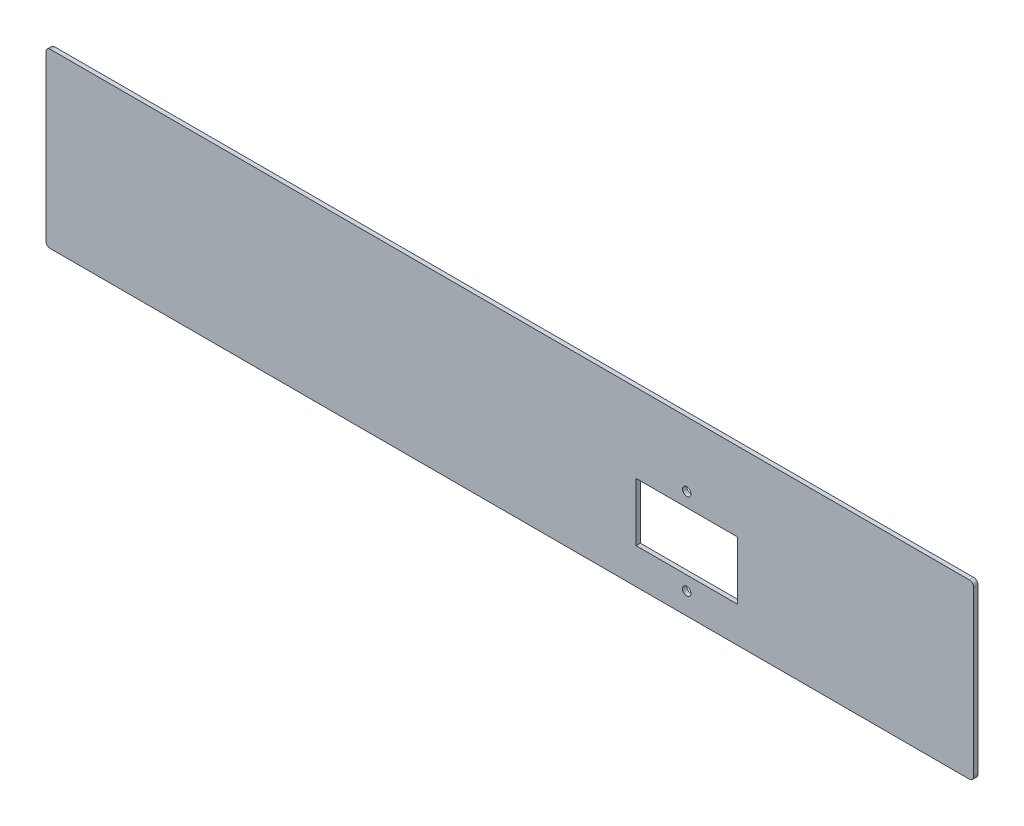
from build123d import *

# Parameters (mm, degrees)
SKETCH1_W           = 430
SKETCH1_H           = 80
SKETCH1_R           = 1.95
SKETCH1_W_2         = 47
SKETCH1_H_2         = 27
BOSS_EXTRUDE1_DEPTH = 2
FILLET1_R           = 2


with BuildPart() as part:
    # Sketch1 → Boss-Extrude1 (new body)
    with BuildSketch(Plane.XY):
        with Locations((-137.924811832, 5.703517588)):
            Rectangle(SKETCH1_W, SKETCH1_H)
        with Locations((-55.924811832, 15.703517588)):
            Circle(SKETCH1_R, mode=Mode.SUBTRACT)
        with Locations((-55.924811832, -24.296482412)):
            Circle(SKETCH1_R, mode=Mode.SUBTRACT)
        with Locations((-55.924811832, -4.296482412)):
            Rectangle(SKETCH1_W_2, SKETCH1_H_2, mode=Mode.SUBTRACT)
    extrude(amount=BOSS_EXTRUDE1_DEPTH)

    # Fillet1
    fillet1_edges = [part.edges().sort_by_distance(p)[0] for p in [
        (77.075188168, 45.703517588, 1),
        (77.075188168, -34.296482412, 1),
        (-352.924811832, -34.296482412, 1),
        (-352.924811832, 45.703517588, 1),
    ]]
    fillet(fillet1_edges, radius=FILLET1_R)


solid = part.part
